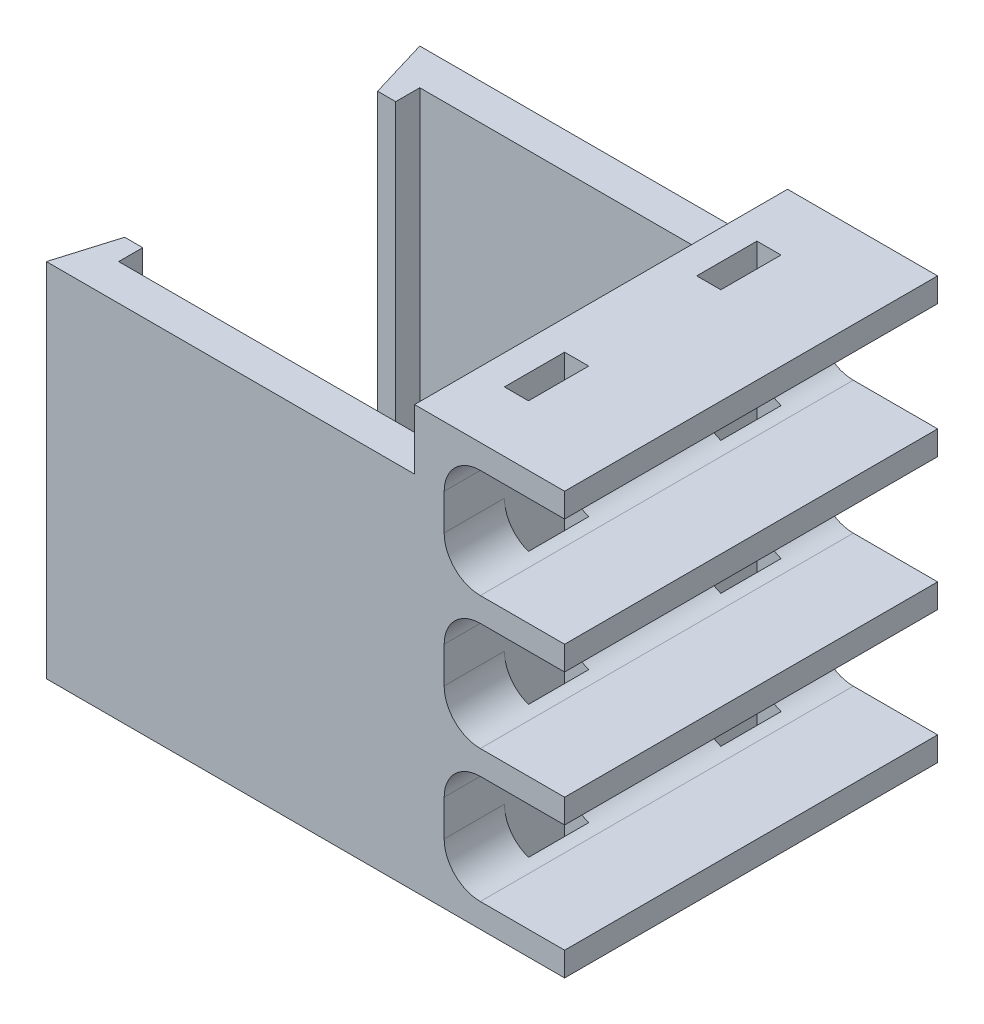
from build123d import *

# Parameters (mm, degrees)
EXTRUDE_1_DEPTH      = 30
CUT_EXTRUDE_4_DEPTH  = 82.16997337
SKETCH_7_W           = 16.60831278
SKETCH_7_H           = 38.473598513
CUT_EXTRUDE_14_DEPTH = 82.16997337
SKETCH_8_W           = 5
SKETCH_8_H           = 30.968526609
EXTRUDE_2_DEPTH      = 30
SKETCH_12_W          = 30.968526609
SKETCH_12_H          = 5
EXTRUDE_11_DEPTH     = 2.76
SKETCH_13_W          = 10
SKETCH_13_H          = 2
EXTRUDE_12_DEPTH     = 30.968526609
SKETCH_14_W          = 2
SKETCH_14_H          = 5
CUT_EXTRUDE_15_DEPTH = 84.147847698
FILLET_1_R           = 3
SKETCH_15_W          = 0.3
SKETCH_15_H          = 5
CUT_EXTRUDE_17_DEPTH = 82.55784374


with BuildPart() as part:
    # Эскиз1 → Бобышка-Вытянуть1 (new body)
    with BuildSketch(Plane(origin=(0, 0, 0), x_dir=(1, 0, 0), z_dir=(0, 1, 0))):
        Polygon((-66.825757576, 34.969739794), (-66.825757576, 29.969739794), (-63.825757576, 29.969739794), (-63.825757576, 31.969739794), (-38.825757576, 31.969739794), (-38.825757576, 6.969739794), (-63.825757576, 6.969739794), (-63.825757576, 8.969739794), (-66.825757576, 8.969739794), (-66.825757576, 3.969739794), (-22.123470102, 3.969739794), (-36.579007505, 34.969739794), align=None)
    extrude(amount=EXTRUDE_1_DEPTH)

    # Эскиз3 → Вырез-Вытянуть4 (cut, through all)
    with BuildSketch(Plane.XZ):
        Polygon((-66.825757576, -3.969739794), (-65.325757576, -8.969739794), (-66.825757576, -8.969739794), align=None)
        Polygon((-66.825757576, -29.969739794), (-66.825757576, -34.969739794), (-65.325757576, -29.969739794), align=None)
    extrude(amount=-CUT_EXTRUDE_4_DEPTH, mode=Mode.SUBTRACT)

    # Эскиз7 → Вырез-Вытянуть14 (cut, through all)
    with BuildSketch(Plane(origin=(0, 0, 0), x_dir=(-1, 0, 0), z_dir=(0, -1, 0))):
        with Locations((27.703474463, 20.539743139)):
            Rectangle(SKETCH_7_W, SKETCH_7_H)
    extrude(amount=-CUT_EXTRUDE_14_DEPTH, mode=Mode.SUBTRACT)

    # Эскиз8 → Бобышка-Вытянуть2 (add)
    with BuildSketch(Plane(origin=(0, 0, 0), x_dir=(-1, 0, 0), z_dir=(0, -1, 0))):
        with Locations((36.298943925, 19.454003098)):
            Rectangle(SKETCH_8_W, SKETCH_8_H)
    extrude(amount=-EXTRUDE_2_DEPTH)

    # Эскиз12 → Бобышка-Вытянуть11 (add)
    with BuildSketch(Plane(origin=(-33.798943925, 0, 0), x_dir=(0, 0, -1), z_dir=(1, 0, 0))):
        with Locations((19.454003098, 32.5)):
            Rectangle(SKETCH_12_W, SKETCH_12_H)
    extrude(amount=-EXTRUDE_11_DEPTH)

    # Эскиз13 → Бобышка-Вытянуть12 (add)
    with BuildSketch(Plane.XY.offset(-3.969739794)):
        with Locations((-28.798943925, 1)):
            Rectangle(SKETCH_13_W, SKETCH_13_H)
        with Locations((-28.798943925, 12)):
            Rectangle(SKETCH_13_W, SKETCH_13_H)
        with Locations((-28.798943925, 23)):
            Rectangle(SKETCH_13_W, SKETCH_13_H)
        with Locations((-28.798943925, 34)):
            Rectangle(SKETCH_13_W, SKETCH_13_H)
    extrude(amount=-EXTRUDE_12_DEPTH)

    # Эскиз14 → Вырез-Вытянуть15 (cut, through all)
    with BuildSketch(Plane(origin=(0, 35, 0), x_dir=(1, 0, 0), z_dir=(0, 1, 0))):
        with Locations((-32.798943925, 27.438266403)):
            Rectangle(SKETCH_14_W, SKETCH_14_H)
        with Locations((-32.798943925, 11.469739794)):
            Rectangle(SKETCH_14_W, SKETCH_14_H)
    extrude(amount=-CUT_EXTRUDE_15_DEPTH, mode=Mode.SUBTRACT)

    # Скругление1
    # the kernel refuses this fillet: 3 mm, written as the material it adds along each edge
    with BuildSketch(Plane(origin=(-33.798943925, 2, -22.438266403), x_dir=(0, 1, 0), z_dir=(0, 0, -1))) as fillet_1_piece_1_section:
        with BuildLine():
            CenterArc((FILLET_1_R, FILLET_1_R), FILLET_1_R, 180, 90)
            Line((0, FILLET_1_R), (0, 0))
            Line((0, 0), (FILLET_1_R, 0))
        make_face()
    fillet_1_piece_1 = extrude(amount=20, mode=Mode.PRIVATE)
    fillet_1_piece_1 = split(fillet_1_piece_1, bisect_by=Plane(origin=(-33.176423652, 2.688760919, -24.938266403), z_dir=(0, 0, 1)), keep=Keep.TOP, mode=Mode.PRIVATE)
    add(fillet_1_piece_1)
    with BuildSketch(Plane(origin=(-33.798943925, 2, -22.438266403), x_dir=(0, 1, 0), z_dir=(0, 0, -1))) as fillet_1_piece_2_section:
        with BuildLine():
            CenterArc((FILLET_1_R, FILLET_1_R), FILLET_1_R, 180, 90)
            Line((0, FILLET_1_R), (0, 0))
            Line((0, 0), (FILLET_1_R, 0))
        make_face()
    fillet_1_piece_2 = extrude(amount=12.5, mode=Mode.PRIVATE)
    fillet_1_piece_2 = split(fillet_1_piece_2, bisect_by=Plane(origin=(-31.798943925, 2.051209323, -27.438266403), z_dir=(1, 0, 0)), keep=Keep.TOP, mode=Mode.PRIVATE)
    add(fillet_1_piece_2)
    with BuildSketch(Plane(origin=(-33.798943925, 2, -29.938266403), x_dir=(0, 1, 0), z_dir=(0, 0, -1)), Plane(origin=(-33.798943925, 13, -29.938266403), x_dir=(0, 1, 0), z_dir=(0, 0, -1)), Plane(origin=(-33.798943925, 24, -29.938266403), x_dir=(0, 1, 0), z_dir=(0, 0, -1)), Plane(origin=(-33.798943925, 24, -3.969739794), x_dir=(0, 1, 0), z_dir=(0, 0, -1)), Plane(origin=(-33.798943925, 13, -3.969739794), x_dir=(0, 1, 0), z_dir=(0, 0, -1)), Plane(origin=(-33.798943925, 2, -3.969739794), x_dir=(0, 1, 0), z_dir=(0, 0, -1))) as fillet_1_piece_3:
        with BuildLine():
            CenterArc((FILLET_1_R, FILLET_1_R), FILLET_1_R, 180, 90)
            Line((0, FILLET_1_R), (0, 0))
            Line((0, 0), (FILLET_1_R, 0))
        make_face()
    extrude(amount=5)
    with BuildSketch(Plane(origin=(-33.798943925, 13, -22.438266403), x_dir=(0, 1, 0), z_dir=(0, 0, -1))) as fillet_1_piece_4_section:
        with BuildLine():
            CenterArc((FILLET_1_R, FILLET_1_R), FILLET_1_R, 180, 90)
            Line((0, FILLET_1_R), (0, 0))
            Line((0, 0), (FILLET_1_R, 0))
        make_face()
    fillet_1_piece_4 = extrude(amount=20, mode=Mode.PRIVATE)
    fillet_1_piece_4 = split(fillet_1_piece_4, bisect_by=Plane(origin=(-33.176423652, 13.688760919, -24.938266403), z_dir=(0, 0, 1)), keep=Keep.TOP, mode=Mode.PRIVATE)
    add(fillet_1_piece_4)
    with BuildSketch(Plane(origin=(-33.798943925, 13, -22.438266403), x_dir=(0, 1, 0), z_dir=(0, 0, -1))) as fillet_1_piece_5_section:
        with BuildLine():
            CenterArc((FILLET_1_R, FILLET_1_R), FILLET_1_R, 180, 90)
            Line((0, FILLET_1_R), (0, 0))
            Line((0, 0), (FILLET_1_R, 0))
        make_face()
    fillet_1_piece_5 = extrude(amount=12.5, mode=Mode.PRIVATE)
    fillet_1_piece_5 = split(fillet_1_piece_5, bisect_by=Plane(origin=(-31.798943925, 13.051209323, -27.438266403), z_dir=(1, 0, 0)), keep=Keep.TOP, mode=Mode.PRIVATE)
    add(fillet_1_piece_5)
    with BuildSketch(Plane(origin=(-33.798943925, 11, -22.438266403), x_dir=(0, -1, 0), z_dir=(0, 0, -1))) as fillet_1_piece_6_section:
        with BuildLine():
            CenterArc((FILLET_1_R, -FILLET_1_R), FILLET_1_R, 90, 90)
            Line((0, -FILLET_1_R), (0, 0))
            Line((0, 0), (FILLET_1_R, 0))
        make_face()
    fillet_1_piece_6 = extrude(amount=20, mode=Mode.PRIVATE)
    fillet_1_piece_6 = split(fillet_1_piece_6, bisect_by=Plane(origin=(-33.176423652, 10.311239081, -24.938266403), z_dir=(0, 0, 1)), keep=Keep.TOP, mode=Mode.PRIVATE)
    add(fillet_1_piece_6)
    with BuildSketch(Plane(origin=(-33.798943925, 11, -22.438266403), x_dir=(0, -1, 0), z_dir=(0, 0, -1))) as fillet_1_piece_7_section:
        with BuildLine():
            CenterArc((FILLET_1_R, -FILLET_1_R), FILLET_1_R, 90, 90)
            Line((0, -FILLET_1_R), (0, 0))
            Line((0, 0), (FILLET_1_R, 0))
        make_face()
    fillet_1_piece_7 = extrude(amount=12.5, mode=Mode.PRIVATE)
    fillet_1_piece_7 = split(fillet_1_piece_7, bisect_by=Plane(origin=(-31.798943925, 10.948790677, -27.438266403), z_dir=(1, 0, 0)), keep=Keep.TOP, mode=Mode.PRIVATE)
    add(fillet_1_piece_7)
    with BuildSketch(Plane(origin=(-33.798943925, 11, -29.938266403), x_dir=(0, -1, 0), z_dir=(0, 0, -1)), Plane(origin=(-33.798943925, 22, -29.938266403), x_dir=(0, -1, 0), z_dir=(0, 0, -1)), Plane(origin=(-33.798943925, 33, -29.938266403), x_dir=(0, -1, 0), z_dir=(0, 0, -1)), Plane(origin=(-33.798943925, 33, -3.969739794), x_dir=(0, -1, 0), z_dir=(0, 0, -1)), Plane(origin=(-33.798943925, 22, -3.969739794), x_dir=(0, -1, 0), z_dir=(0, 0, -1)), Plane(origin=(-33.798943925, 11, -3.969739794), x_dir=(0, -1, 0), z_dir=(0, 0, -1))) as fillet_1_piece_8:
        with BuildLine():
            CenterArc((FILLET_1_R, -FILLET_1_R), FILLET_1_R, 90, 90)
            Line((0, -FILLET_1_R), (0, 0))
            Line((0, 0), (FILLET_1_R, 0))
        make_face()
    extrude(amount=5)
    with BuildSketch(Plane(origin=(-33.798943925, 24, -22.438266403), x_dir=(0, 1, 0), z_dir=(0, 0, -1))) as fillet_1_piece_9_section:
        with BuildLine():
            CenterArc((FILLET_1_R, FILLET_1_R), FILLET_1_R, 180, 90)
            Line((0, FILLET_1_R), (0, 0))
            Line((0, 0), (FILLET_1_R, 0))
        make_face()
    fillet_1_piece_9 = extrude(amount=20, mode=Mode.PRIVATE)
    fillet_1_piece_9 = split(fillet_1_piece_9, bisect_by=Plane(origin=(-33.176423652, 24.688760919, -24.938266403), z_dir=(0, 0, 1)), keep=Keep.TOP, mode=Mode.PRIVATE)
    add(fillet_1_piece_9)
    with BuildSketch(Plane(origin=(-33.798943925, 24, -22.438266403), x_dir=(0, 1, 0), z_dir=(0, 0, -1))) as fillet_1_piece_10_section:
        with BuildLine():
            CenterArc((FILLET_1_R, FILLET_1_R), FILLET_1_R, 180, 90)
            Line((0, FILLET_1_R), (0, 0))
            Line((0, 0), (FILLET_1_R, 0))
        make_face()
    fillet_1_piece_10 = extrude(amount=12.5, mode=Mode.PRIVATE)
    fillet_1_piece_10 = split(fillet_1_piece_10, bisect_by=Plane(origin=(-31.798943925, 24.051209323, -27.438266403), z_dir=(1, 0, 0)), keep=Keep.TOP, mode=Mode.PRIVATE)
    add(fillet_1_piece_10)
    with BuildSketch(Plane(origin=(-33.798943925, 22, -22.438266403), x_dir=(0, -1, 0), z_dir=(0, 0, -1))) as fillet_1_piece_11_section:
        with BuildLine():
            CenterArc((FILLET_1_R, -FILLET_1_R), FILLET_1_R, 90, 90)
            Line((0, -FILLET_1_R), (0, 0))
            Line((0, 0), (FILLET_1_R, 0))
        make_face()
    fillet_1_piece_11 = extrude(amount=20, mode=Mode.PRIVATE)
    fillet_1_piece_11 = split(fillet_1_piece_11, bisect_by=Plane(origin=(-33.176423652, 21.311239081, -24.938266403), z_dir=(0, 0, 1)), keep=Keep.TOP, mode=Mode.PRIVATE)
    add(fillet_1_piece_11)
    with BuildSketch(Plane(origin=(-33.798943925, 22, -22.438266403), x_dir=(0, -1, 0), z_dir=(0, 0, -1))) as fillet_1_piece_12_section:
        with BuildLine():
            CenterArc((FILLET_1_R, -FILLET_1_R), FILLET_1_R, 90, 90)
            Line((0, -FILLET_1_R), (0, 0))
            Line((0, 0), (FILLET_1_R, 0))
        make_face()
    fillet_1_piece_12 = extrude(amount=12.5, mode=Mode.PRIVATE)
    fillet_1_piece_12 = split(fillet_1_piece_12, bisect_by=Plane(origin=(-31.798943925, 21.948790677, -27.438266403), z_dir=(1, 0, 0)), keep=Keep.TOP, mode=Mode.PRIVATE)
    add(fillet_1_piece_12)
    with BuildSketch(Plane(origin=(-33.798943925, 33, -22.438266403), x_dir=(0, -1, 0), z_dir=(0, 0, -1))) as fillet_1_piece_13_section:
        with BuildLine():
            CenterArc((FILLET_1_R, -FILLET_1_R), FILLET_1_R, 90, 90)
            Line((0, -FILLET_1_R), (0, 0))
            Line((0, 0), (FILLET_1_R, 0))
        make_face()
    fillet_1_piece_13 = extrude(amount=20, mode=Mode.PRIVATE)
    fillet_1_piece_13 = split(fillet_1_piece_13, bisect_by=Plane(origin=(-33.176423652, 32.311239081, -24.938266403), z_dir=(0, 0, 1)), keep=Keep.TOP, mode=Mode.PRIVATE)
    add(fillet_1_piece_13)
    with BuildSketch(Plane(origin=(-33.798943925, 33, -22.438266403), x_dir=(0, -1, 0), z_dir=(0, 0, -1))) as fillet_1_piece_14_section:
        with BuildLine():
            CenterArc((FILLET_1_R, -FILLET_1_R), FILLET_1_R, 90, 90)
            Line((0, -FILLET_1_R), (0, 0))
            Line((0, 0), (FILLET_1_R, 0))
        make_face()
    fillet_1_piece_14 = extrude(amount=12.5, mode=Mode.PRIVATE)
    fillet_1_piece_14 = split(fillet_1_piece_14, bisect_by=Plane(origin=(-31.798943925, 32.948790677, -27.438266403), z_dir=(1, 0, 0)), keep=Keep.TOP, mode=Mode.PRIVATE)
    add(fillet_1_piece_14)
    with BuildSketch(Plane(origin=(-33.798943925, 33, -6.469739794), x_dir=(0, -1, 0), z_dir=(0, 0, -1))) as fillet_1_piece_15_section:
        with BuildLine():
            CenterArc((FILLET_1_R, -FILLET_1_R), FILLET_1_R, 90, 90)
            Line((0, -FILLET_1_R), (0, 0))
            Line((0, 0), (FILLET_1_R, 0))
        make_face()
    fillet_1_piece_15 = extrude(amount=25.968526609, mode=Mode.PRIVATE)
    fillet_1_piece_15 = split(fillet_1_piece_15, bisect_by=Plane(origin=(-33.176423652, 32.311239081, -8.969739794), z_dir=(0, 0, 1)), keep=Keep.TOP, mode=Mode.PRIVATE)
    add(fillet_1_piece_15)
    with BuildSketch(Plane(origin=(-33.798943925, 33, -6.469739794), x_dir=(0, -1, 0), z_dir=(0, 0, -1))) as fillet_1_piece_16_section:
        with BuildLine():
            CenterArc((FILLET_1_R, -FILLET_1_R), FILLET_1_R, 90, 90)
            Line((0, -FILLET_1_R), (0, 0))
            Line((0, 0), (FILLET_1_R, 0))
        make_face()
    fillet_1_piece_16 = extrude(amount=25.968526609, mode=Mode.PRIVATE)
    fillet_1_piece_16 = split(fillet_1_piece_16, bisect_by=Plane(origin=(-31.798943925, 32.948790677, -11.469739794), z_dir=(1, 0, 0)), keep=Keep.TOP, mode=Mode.PRIVATE)
    add(fillet_1_piece_16)
    with BuildSketch(Plane(origin=(-33.798943925, 33, -13.969739794), x_dir=(0, -1, 0), z_dir=(0, 0, -1)), Plane(origin=(-33.798943925, 22, -13.969739794), x_dir=(0, -1, 0), z_dir=(0, 0, -1)), Plane(origin=(-33.798943925, 11, -13.969739794), x_dir=(0, -1, 0), z_dir=(0, 0, -1))) as fillet_1_piece_17:
        with BuildLine():
            CenterArc((FILLET_1_R, -FILLET_1_R), FILLET_1_R, 90, 90)
            Line((0, -FILLET_1_R), (0, 0))
            Line((0, 0), (FILLET_1_R, 0))
        make_face()
    extrude(amount=10.968526609)
    with BuildSketch(Plane(origin=(-33.798943925, 33, -6.469739794), x_dir=(0, -1, 0), z_dir=(0, 0, -1))) as fillet_1_piece_18_section:
        with BuildLine():
            CenterArc((FILLET_1_R, -FILLET_1_R), FILLET_1_R, 90, 90)
            Line((0, -FILLET_1_R), (0, 0))
            Line((0, 0), (FILLET_1_R, 0))
        make_face()
    fillet_1_piece_18 = extrude(amount=25.968526609, mode=Mode.PRIVATE)
    fillet_1_piece_18 = split(fillet_1_piece_18, bisect_by=Plane(origin=(-33.176423652, 32.311239081, -29.938266403), z_dir=(0, 0, -1)), keep=Keep.TOP, mode=Mode.PRIVATE)
    add(fillet_1_piece_18)
    with BuildSketch(Plane(origin=(-33.798943925, 33, 3.530260206), x_dir=(0, -1, 0), z_dir=(0, 0, -1))) as fillet_1_piece_19_section:
        with BuildLine():
            CenterArc((FILLET_1_R, -FILLET_1_R), FILLET_1_R, 90, 90)
            Line((0, -FILLET_1_R), (0, 0))
            Line((0, 0), (FILLET_1_R, 0))
        make_face()
    fillet_1_piece_19 = extrude(amount=20, mode=Mode.PRIVATE)
    fillet_1_piece_19 = split(fillet_1_piece_19, bisect_by=Plane(origin=(-31.550396037, 32.948790677, -8.969739794), z_dir=(0, 0, -1)), keep=Keep.TOP, mode=Mode.PRIVATE)
    fillet_1_piece_19 = split(fillet_1_piece_19, bisect_by=Plane(origin=(-31.798943925, 32.948790677, -11.469739794), z_dir=(1, 0, 0)), keep=Keep.TOP, mode=Mode.PRIVATE)
    add(fillet_1_piece_19)
    with BuildSketch(Plane(origin=(-33.798943925, 33, 3.530260206), x_dir=(0, -1, 0), z_dir=(0, 0, -1))) as fillet_1_piece_20_section:
        with BuildLine():
            CenterArc((FILLET_1_R, -FILLET_1_R), FILLET_1_R, 90, 90)
            Line((0, -FILLET_1_R), (0, 0))
            Line((0, 0), (FILLET_1_R, 0))
        make_face()
    fillet_1_piece_20 = extrude(amount=20, mode=Mode.PRIVATE)
    fillet_1_piece_20 = split(fillet_1_piece_20, bisect_by=Plane(origin=(-33.176423652, 32.311239081, -13.969739794), z_dir=(0, 0, -1)), keep=Keep.TOP, mode=Mode.PRIVATE)
    add(fillet_1_piece_20)
    with BuildSketch(Plane(origin=(-33.798943925, 24, -6.469739794), x_dir=(0, 1, 0), z_dir=(0, 0, -1))) as fillet_1_piece_21_section:
        with BuildLine():
            CenterArc((FILLET_1_R, FILLET_1_R), FILLET_1_R, 180, 90)
            Line((0, FILLET_1_R), (0, 0))
            Line((0, 0), (FILLET_1_R, 0))
        make_face()
    fillet_1_piece_21 = extrude(amount=25.968526609, mode=Mode.PRIVATE)
    fillet_1_piece_21 = split(fillet_1_piece_21, bisect_by=Plane(origin=(-33.176423652, 24.688760919, -8.969739794), z_dir=(0, 0, 1)), keep=Keep.TOP, mode=Mode.PRIVATE)
    add(fillet_1_piece_21)
    with BuildSketch(Plane(origin=(-33.798943925, 24, -6.469739794), x_dir=(0, 1, 0), z_dir=(0, 0, -1))) as fillet_1_piece_22_section:
        with BuildLine():
            CenterArc((FILLET_1_R, FILLET_1_R), FILLET_1_R, 180, 90)
            Line((0, FILLET_1_R), (0, 0))
            Line((0, 0), (FILLET_1_R, 0))
        make_face()
    fillet_1_piece_22 = extrude(amount=25.968526609, mode=Mode.PRIVATE)
    fillet_1_piece_22 = split(fillet_1_piece_22, bisect_by=Plane(origin=(-31.798943925, 24.051209323, -11.469739794), z_dir=(1, 0, 0)), keep=Keep.TOP, mode=Mode.PRIVATE)
    add(fillet_1_piece_22)
    with BuildSketch(Plane(origin=(-33.798943925, 24, -13.969739794), x_dir=(0, 1, 0), z_dir=(0, 0, -1)), Plane(origin=(-33.798943925, 13, -13.969739794), x_dir=(0, 1, 0), z_dir=(0, 0, -1)), Plane(origin=(-33.798943925, 2, -13.969739794), x_dir=(0, 1, 0), z_dir=(0, 0, -1))) as fillet_1_piece_23:
        with BuildLine():
            CenterArc((FILLET_1_R, FILLET_1_R), FILLET_1_R, 180, 90)
            Line((0, FILLET_1_R), (0, 0))
            Line((0, 0), (FILLET_1_R, 0))
        make_face()
    extrude(amount=10.968526609)
    with BuildSketch(Plane(origin=(-33.798943925, 24, -6.469739794), x_dir=(0, 1, 0), z_dir=(0, 0, -1))) as fillet_1_piece_24_section:
        with BuildLine():
            CenterArc((FILLET_1_R, FILLET_1_R), FILLET_1_R, 180, 90)
            Line((0, FILLET_1_R), (0, 0))
            Line((0, 0), (FILLET_1_R, 0))
        make_face()
    fillet_1_piece_24 = extrude(amount=25.968526609, mode=Mode.PRIVATE)
    fillet_1_piece_24 = split(fillet_1_piece_24, bisect_by=Plane(origin=(-33.176423652, 24.688760919, -29.938266403), z_dir=(0, 0, -1)), keep=Keep.TOP, mode=Mode.PRIVATE)
    add(fillet_1_piece_24)
    with BuildSketch(Plane(origin=(-33.798943925, 24, 3.530260206), x_dir=(0, 1, 0), z_dir=(0, 0, -1))) as fillet_1_piece_25_section:
        with BuildLine():
            CenterArc((FILLET_1_R, FILLET_1_R), FILLET_1_R, 180, 90)
            Line((0, FILLET_1_R), (0, 0))
            Line((0, 0), (FILLET_1_R, 0))
        make_face()
    fillet_1_piece_25 = extrude(amount=20, mode=Mode.PRIVATE)
    fillet_1_piece_25 = split(fillet_1_piece_25, bisect_by=Plane(origin=(-31.550396037, 24.051209323, -8.969739794), z_dir=(0, 0, -1)), keep=Keep.TOP, mode=Mode.PRIVATE)
    fillet_1_piece_25 = split(fillet_1_piece_25, bisect_by=Plane(origin=(-31.798943925, 24.051209323, -11.469739794), z_dir=(1, 0, 0)), keep=Keep.TOP, mode=Mode.PRIVATE)
    add(fillet_1_piece_25)
    with BuildSketch(Plane(origin=(-33.798943925, 24, 3.530260206), x_dir=(0, 1, 0), z_dir=(0, 0, -1))) as fillet_1_piece_26_section:
        with BuildLine():
            CenterArc((FILLET_1_R, FILLET_1_R), FILLET_1_R, 180, 90)
            Line((0, FILLET_1_R), (0, 0))
            Line((0, 0), (FILLET_1_R, 0))
        make_face()
    fillet_1_piece_26 = extrude(amount=20, mode=Mode.PRIVATE)
    fillet_1_piece_26 = split(fillet_1_piece_26, bisect_by=Plane(origin=(-33.176423652, 24.688760919, -13.969739794), z_dir=(0, 0, -1)), keep=Keep.TOP, mode=Mode.PRIVATE)
    add(fillet_1_piece_26)
    with BuildSketch(Plane(origin=(-33.798943925, 22, -6.469739794), x_dir=(0, -1, 0), z_dir=(0, 0, -1))) as fillet_1_piece_27_section:
        with BuildLine():
            CenterArc((FILLET_1_R, -FILLET_1_R), FILLET_1_R, 90, 90)
            Line((0, -FILLET_1_R), (0, 0))
            Line((0, 0), (FILLET_1_R, 0))
        make_face()
    fillet_1_piece_27 = extrude(amount=25.968526609, mode=Mode.PRIVATE)
    fillet_1_piece_27 = split(fillet_1_piece_27, bisect_by=Plane(origin=(-33.176423652, 21.311239081, -8.969739794), z_dir=(0, 0, 1)), keep=Keep.TOP, mode=Mode.PRIVATE)
    add(fillet_1_piece_27)
    with BuildSketch(Plane(origin=(-33.798943925, 22, -6.469739794), x_dir=(0, -1, 0), z_dir=(0, 0, -1))) as fillet_1_piece_28_section:
        with BuildLine():
            CenterArc((FILLET_1_R, -FILLET_1_R), FILLET_1_R, 90, 90)
            Line((0, -FILLET_1_R), (0, 0))
            Line((0, 0), (FILLET_1_R, 0))
        make_face()
    fillet_1_piece_28 = extrude(amount=25.968526609, mode=Mode.PRIVATE)
    fillet_1_piece_28 = split(fillet_1_piece_28, bisect_by=Plane(origin=(-31.798943925, 21.948790677, -11.469739794), z_dir=(1, 0, 0)), keep=Keep.TOP, mode=Mode.PRIVATE)
    add(fillet_1_piece_28)
    with BuildSketch(Plane(origin=(-33.798943925, 22, -6.469739794), x_dir=(0, -1, 0), z_dir=(0, 0, -1))) as fillet_1_piece_29_section:
        with BuildLine():
            CenterArc((FILLET_1_R, -FILLET_1_R), FILLET_1_R, 90, 90)
            Line((0, -FILLET_1_R), (0, 0))
            Line((0, 0), (FILLET_1_R, 0))
        make_face()
    fillet_1_piece_29 = extrude(amount=25.968526609, mode=Mode.PRIVATE)
    fillet_1_piece_29 = split(fillet_1_piece_29, bisect_by=Plane(origin=(-33.176423652, 21.311239081, -29.938266403), z_dir=(0, 0, -1)), keep=Keep.TOP, mode=Mode.PRIVATE)
    add(fillet_1_piece_29)
    with BuildSketch(Plane(origin=(-33.798943925, 22, 3.530260206), x_dir=(0, -1, 0), z_dir=(0, 0, -1))) as fillet_1_piece_30_section:
        with BuildLine():
            CenterArc((FILLET_1_R, -FILLET_1_R), FILLET_1_R, 90, 90)
            Line((0, -FILLET_1_R), (0, 0))
            Line((0, 0), (FILLET_1_R, 0))
        make_face()
    fillet_1_piece_30 = extrude(amount=20, mode=Mode.PRIVATE)
    fillet_1_piece_30 = split(fillet_1_piece_30, bisect_by=Plane(origin=(-31.550396037, 21.948790677, -8.969739794), z_dir=(0, 0, -1)), keep=Keep.TOP, mode=Mode.PRIVATE)
    fillet_1_piece_30 = split(fillet_1_piece_30, bisect_by=Plane(origin=(-31.798943925, 21.948790677, -11.469739794), z_dir=(1, 0, 0)), keep=Keep.TOP, mode=Mode.PRIVATE)
    add(fillet_1_piece_30)
    with BuildSketch(Plane(origin=(-33.798943925, 22, 3.530260206), x_dir=(0, -1, 0), z_dir=(0, 0, -1))) as fillet_1_piece_31_section:
        with BuildLine():
            CenterArc((FILLET_1_R, -FILLET_1_R), FILLET_1_R, 90, 90)
            Line((0, -FILLET_1_R), (0, 0))
            Line((0, 0), (FILLET_1_R, 0))
        make_face()
    fillet_1_piece_31 = extrude(amount=20, mode=Mode.PRIVATE)
    fillet_1_piece_31 = split(fillet_1_piece_31, bisect_by=Plane(origin=(-33.176423652, 21.311239081, -13.969739794), z_dir=(0, 0, -1)), keep=Keep.TOP, mode=Mode.PRIVATE)
    add(fillet_1_piece_31)
    with BuildSketch(Plane(origin=(-33.798943925, 13, -6.469739794), x_dir=(0, 1, 0), z_dir=(0, 0, -1))) as fillet_1_piece_32_section:
        with BuildLine():
            CenterArc((FILLET_1_R, FILLET_1_R), FILLET_1_R, 180, 90)
            Line((0, FILLET_1_R), (0, 0))
            Line((0, 0), (FILLET_1_R, 0))
        make_face()
    fillet_1_piece_32 = extrude(amount=25.968526609, mode=Mode.PRIVATE)
    fillet_1_piece_32 = split(fillet_1_piece_32, bisect_by=Plane(origin=(-33.176423652, 13.688760919, -8.969739794), z_dir=(0, 0, 1)), keep=Keep.TOP, mode=Mode.PRIVATE)
    add(fillet_1_piece_32)
    with BuildSketch(Plane(origin=(-33.798943925, 13, -6.469739794), x_dir=(0, 1, 0), z_dir=(0, 0, -1))) as fillet_1_piece_33_section:
        with BuildLine():
            CenterArc((FILLET_1_R, FILLET_1_R), FILLET_1_R, 180, 90)
            Line((0, FILLET_1_R), (0, 0))
            Line((0, 0), (FILLET_1_R, 0))
        make_face()
    fillet_1_piece_33 = extrude(amount=25.968526609, mode=Mode.PRIVATE)
    fillet_1_piece_33 = split(fillet_1_piece_33, bisect_by=Plane(origin=(-31.798943925, 13.051209323, -11.469739794), z_dir=(1, 0, 0)), keep=Keep.TOP, mode=Mode.PRIVATE)
    add(fillet_1_piece_33)
    with BuildSketch(Plane(origin=(-33.798943925, 13, -6.469739794), x_dir=(0, 1, 0), z_dir=(0, 0, -1))) as fillet_1_piece_34_section:
        with BuildLine():
            CenterArc((FILLET_1_R, FILLET_1_R), FILLET_1_R, 180, 90)
            Line((0, FILLET_1_R), (0, 0))
            Line((0, 0), (FILLET_1_R, 0))
        make_face()
    fillet_1_piece_34 = extrude(amount=25.968526609, mode=Mode.PRIVATE)
    fillet_1_piece_34 = split(fillet_1_piece_34, bisect_by=Plane(origin=(-33.176423652, 13.688760919, -29.938266403), z_dir=(0, 0, -1)), keep=Keep.TOP, mode=Mode.PRIVATE)
    add(fillet_1_piece_34)
    with BuildSketch(Plane(origin=(-33.798943925, 13, 3.530260206), x_dir=(0, 1, 0), z_dir=(0, 0, -1))) as fillet_1_piece_35_section:
        with BuildLine():
            CenterArc((FILLET_1_R, FILLET_1_R), FILLET_1_R, 180, 90)
            Line((0, FILLET_1_R), (0, 0))
            Line((0, 0), (FILLET_1_R, 0))
        make_face()
    fillet_1_piece_35 = extrude(amount=20, mode=Mode.PRIVATE)
    fillet_1_piece_35 = split(fillet_1_piece_35, bisect_by=Plane(origin=(-31.550396037, 13.051209323, -8.969739794), z_dir=(0, 0, -1)), keep=Keep.TOP, mode=Mode.PRIVATE)
    fillet_1_piece_35 = split(fillet_1_piece_35, bisect_by=Plane(origin=(-31.798943925, 13.051209323, -11.469739794), z_dir=(1, 0, 0)), keep=Keep.TOP, mode=Mode.PRIVATE)
    add(fillet_1_piece_35)
    with BuildSketch(Plane(origin=(-33.798943925, 13, 3.530260206), x_dir=(0, 1, 0), z_dir=(0, 0, -1))) as fillet_1_piece_36_section:
        with BuildLine():
            CenterArc((FILLET_1_R, FILLET_1_R), FILLET_1_R, 180, 90)
            Line((0, FILLET_1_R), (0, 0))
            Line((0, 0), (FILLET_1_R, 0))
        make_face()
    fillet_1_piece_36 = extrude(amount=20, mode=Mode.PRIVATE)
    fillet_1_piece_36 = split(fillet_1_piece_36, bisect_by=Plane(origin=(-33.176423652, 13.688760919, -13.969739794), z_dir=(0, 0, -1)), keep=Keep.TOP, mode=Mode.PRIVATE)
    add(fillet_1_piece_36)
    with BuildSketch(Plane(origin=(-33.798943925, 11, -6.469739794), x_dir=(0, -1, 0), z_dir=(0, 0, -1))) as fillet_1_piece_37_section:
        with BuildLine():
            CenterArc((FILLET_1_R, -FILLET_1_R), FILLET_1_R, 90, 90)
            Line((0, -FILLET_1_R), (0, 0))
            Line((0, 0), (FILLET_1_R, 0))
        make_face()
    fillet_1_piece_37 = extrude(amount=25.968526609, mode=Mode.PRIVATE)
    fillet_1_piece_37 = split(fillet_1_piece_37, bisect_by=Plane(origin=(-33.176423652, 10.311239081, -8.969739794), z_dir=(0, 0, 1)), keep=Keep.TOP, mode=Mode.PRIVATE)
    add(fillet_1_piece_37)
    with BuildSketch(Plane(origin=(-33.798943925, 11, -6.469739794), x_dir=(0, -1, 0), z_dir=(0, 0, -1))) as fillet_1_piece_38_section:
        with BuildLine():
            CenterArc((FILLET_1_R, -FILLET_1_R), FILLET_1_R, 90, 90)
            Line((0, -FILLET_1_R), (0, 0))
            Line((0, 0), (FILLET_1_R, 0))
        make_face()
    fillet_1_piece_38 = extrude(amount=25.968526609, mode=Mode.PRIVATE)
    fillet_1_piece_38 = split(fillet_1_piece_38, bisect_by=Plane(origin=(-31.798943925, 10.948790677, -11.469739794), z_dir=(1, 0, 0)), keep=Keep.TOP, mode=Mode.PRIVATE)
    add(fillet_1_piece_38)
    with BuildSketch(Plane(origin=(-33.798943925, 11, -6.469739794), x_dir=(0, -1, 0), z_dir=(0, 0, -1))) as fillet_1_piece_39_section:
        with BuildLine():
            CenterArc((FILLET_1_R, -FILLET_1_R), FILLET_1_R, 90, 90)
            Line((0, -FILLET_1_R), (0, 0))
            Line((0, 0), (FILLET_1_R, 0))
        make_face()
    fillet_1_piece_39 = extrude(amount=25.968526609, mode=Mode.PRIVATE)
    fillet_1_piece_39 = split(fillet_1_piece_39, bisect_by=Plane(origin=(-33.176423652, 10.311239081, -29.938266403), z_dir=(0, 0, -1)), keep=Keep.TOP, mode=Mode.PRIVATE)
    add(fillet_1_piece_39)
    with BuildSketch(Plane(origin=(-33.798943925, 11, 3.530260206), x_dir=(0, -1, 0), z_dir=(0, 0, -1))) as fillet_1_piece_40_section:
        with BuildLine():
            CenterArc((FILLET_1_R, -FILLET_1_R), FILLET_1_R, 90, 90)
            Line((0, -FILLET_1_R), (0, 0))
            Line((0, 0), (FILLET_1_R, 0))
        make_face()
    fillet_1_piece_40 = extrude(amount=20, mode=Mode.PRIVATE)
    fillet_1_piece_40 = split(fillet_1_piece_40, bisect_by=Plane(origin=(-31.550396037, 10.948790677, -8.969739794), z_dir=(0, 0, -1)), keep=Keep.TOP, mode=Mode.PRIVATE)
    fillet_1_piece_40 = split(fillet_1_piece_40, bisect_by=Plane(origin=(-31.798943925, 10.948790677, -11.469739794), z_dir=(1, 0, 0)), keep=Keep.TOP, mode=Mode.PRIVATE)
    add(fillet_1_piece_40)
    with BuildSketch(Plane(origin=(-33.798943925, 11, 3.530260206), x_dir=(0, -1, 0), z_dir=(0, 0, -1))) as fillet_1_piece_41_section:
        with BuildLine():
            CenterArc((FILLET_1_R, -FILLET_1_R), FILLET_1_R, 90, 90)
            Line((0, -FILLET_1_R), (0, 0))
            Line((0, 0), (FILLET_1_R, 0))
        make_face()
    fillet_1_piece_41 = extrude(amount=20, mode=Mode.PRIVATE)
    fillet_1_piece_41 = split(fillet_1_piece_41, bisect_by=Plane(origin=(-33.176423652, 10.311239081, -13.969739794), z_dir=(0, 0, -1)), keep=Keep.TOP, mode=Mode.PRIVATE)
    add(fillet_1_piece_41)
    with BuildSketch(Plane(origin=(-33.798943925, 2, -6.469739794), x_dir=(0, 1, 0), z_dir=(0, 0, -1))) as fillet_1_piece_42_section:
        with BuildLine():
            CenterArc((FILLET_1_R, FILLET_1_R), FILLET_1_R, 180, 90)
            Line((0, FILLET_1_R), (0, 0))
            Line((0, 0), (FILLET_1_R, 0))
        make_face()
    fillet_1_piece_42 = extrude(amount=25.968526609, mode=Mode.PRIVATE)
    fillet_1_piece_42 = split(fillet_1_piece_42, bisect_by=Plane(origin=(-33.176423652, 2.688760919, -8.969739794), z_dir=(0, 0, 1)), keep=Keep.TOP, mode=Mode.PRIVATE)
    add(fillet_1_piece_42)
    with BuildSketch(Plane(origin=(-33.798943925, 2, -6.469739794), x_dir=(0, 1, 0), z_dir=(0, 0, -1))) as fillet_1_piece_43_section:
        with BuildLine():
            CenterArc((FILLET_1_R, FILLET_1_R), FILLET_1_R, 180, 90)
            Line((0, FILLET_1_R), (0, 0))
            Line((0, 0), (FILLET_1_R, 0))
        make_face()
    fillet_1_piece_43 = extrude(amount=25.968526609, mode=Mode.PRIVATE)
    fillet_1_piece_43 = split(fillet_1_piece_43, bisect_by=Plane(origin=(-31.798943925, 2.051209323, -11.469739794), z_dir=(1, 0, 0)), keep=Keep.TOP, mode=Mode.PRIVATE)
    add(fillet_1_piece_43)
    with BuildSketch(Plane(origin=(-33.798943925, 2, -6.469739794), x_dir=(0, 1, 0), z_dir=(0, 0, -1))) as fillet_1_piece_44_section:
        with BuildLine():
            CenterArc((FILLET_1_R, FILLET_1_R), FILLET_1_R, 180, 90)
            Line((0, FILLET_1_R), (0, 0))
            Line((0, 0), (FILLET_1_R, 0))
        make_face()
    fillet_1_piece_44 = extrude(amount=25.968526609, mode=Mode.PRIVATE)
    fillet_1_piece_44 = split(fillet_1_piece_44, bisect_by=Plane(origin=(-33.176423652, 2.688760919, -29.938266403), z_dir=(0, 0, -1)), keep=Keep.TOP, mode=Mode.PRIVATE)
    add(fillet_1_piece_44)
    with BuildSketch(Plane(origin=(-33.798943925, 2, 3.530260206), x_dir=(0, 1, 0), z_dir=(0, 0, -1))) as fillet_1_piece_45_section:
        with BuildLine():
            CenterArc((FILLET_1_R, FILLET_1_R), FILLET_1_R, 180, 90)
            Line((0, FILLET_1_R), (0, 0))
            Line((0, 0), (FILLET_1_R, 0))
        make_face()
    fillet_1_piece_45 = extrude(amount=20, mode=Mode.PRIVATE)
    fillet_1_piece_45 = split(fillet_1_piece_45, bisect_by=Plane(origin=(-31.550396037, 2.051209323, -8.969739794), z_dir=(0, 0, -1)), keep=Keep.TOP, mode=Mode.PRIVATE)
    fillet_1_piece_45 = split(fillet_1_piece_45, bisect_by=Plane(origin=(-31.798943925, 2.051209323, -11.469739794), z_dir=(1, 0, 0)), keep=Keep.TOP, mode=Mode.PRIVATE)
    add(fillet_1_piece_45)
    with BuildSketch(Plane(origin=(-33.798943925, 2, 3.530260206), x_dir=(0, 1, 0), z_dir=(0, 0, -1))) as fillet_1_piece_46_section:
        with BuildLine():
            CenterArc((FILLET_1_R, FILLET_1_R), FILLET_1_R, 180, 90)
            Line((0, FILLET_1_R), (0, 0))
            Line((0, 0), (FILLET_1_R, 0))
        make_face()
    fillet_1_piece_46 = extrude(amount=20, mode=Mode.PRIVATE)
    fillet_1_piece_46 = split(fillet_1_piece_46, bisect_by=Plane(origin=(-33.176423652, 2.688760919, -13.969739794), z_dir=(0, 0, -1)), keep=Keep.TOP, mode=Mode.PRIVATE)
    add(fillet_1_piece_46)

    # Эскиз15 → Вырез-Вытянуть17 (cut, through all)
    with BuildSketch(Plane.XY.offset(-3.969739794)):
        with Locations((-36.408943925, 32.5)):
            Rectangle(SKETCH_15_W, SKETCH_15_H)
    extrude(amount=-CUT_EXTRUDE_17_DEPTH, mode=Mode.SUBTRACT)


solid = part.part
